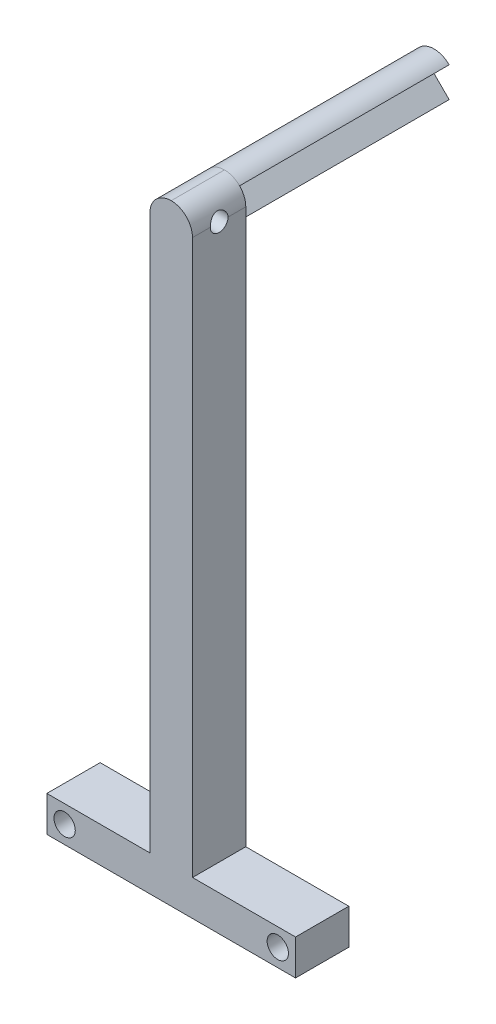
from build123d import *

# Parameters (mm, degrees)
BOSS_EXTRU_1_DEPTH      = 59
BOSS_EXTRU_2_DEPTH      = 15
CONG_1_R                = 6
BOSS_EXTRU_3_DEPTH      = 150
ESQUISSE5_W             = 15
ESQUISSE5_H             = 10
BOSS_EXTRU_4_DEPTH      = 35
ENL_V_MAT_EXTRU_1_REACH = 187.086
ESQUISSE6_R             = 3
ENL_V_MAT_EXTRU_2_REACH = 188.314


with BuildPart() as part:
    # Esquisse1 → Boss.-Extru.1 (new body)
    with BuildSketch(Plane.XY):
        with BuildLine():
            Line((4.242640687, -4.242640687), (0, 0))
            Line((0, 0), (0, 6))
            ThreePointArc((0, 6), (-5.543277195, -2.296100594), (4.242640687, -4.242640687))
        make_face()
        with BuildLine():
            Line((0, 6), (0, 0))
            Line((0, 0), (4.242640687, 4.242640687))
            ThreePointArc((4.242640687, 4.242640687), (2.296100594, 5.543277195), (0, 6))
        make_face()
    extrude(amount=BOSS_EXTRU_1_DEPTH)

    # Esquisse2 → Boss.-Extru.2 (add)
    with BuildSketch(Plane.XY.offset(59)):
        with BuildLine():
            ThreePointArc((0, -6), (-4.242640708, -4.242640666), (-6, 5.9e-08))
            Line((-6, 5.9e-08), (-6, -6))
            Line((-6, -6), (0, -6))
        make_face()
        with BuildLine():
            Line((0, 0), (0, 6))
            ThreePointArc((0, 6), (-4.242640666, 4.242640708), (-6, 5.9e-08))
            ThreePointArc((-6, 5.9e-08), (-4.242640708, -4.242640666), (0, -6))
            Line((0, -6), (0, 0))
        make_face()
        with BuildLine():
            ThreePointArc((4.242640687, 4.242640687), (2.296100594, 5.543277195), (0, 6))
            Line((0, 6), (0, 0))
            Line((0, 0), (4.242640687, 4.242640687))
        make_face()
        with BuildLine():
            Line((6, 6), (0, 6))
            ThreePointArc((0, 6), (2.296100594, 5.543277195), (4.242640687, 4.242640687))
            Line((4.242640687, 4.242640687), (0, 0))
            Line((0, 0), (4.242640687, -4.242640687))
            ThreePointArc((4.242640687, -4.242640687), (2.296100594, -5.543277195), (0, -6))
            Line((0, -6), (6, -6))
            Line((6, -6), (6, 6))
        make_face()
        with BuildLine():
            ThreePointArc((-6, 5.9e-08), (-4.242640666, 4.242640708), (0, 6))
            Line((0, 6), (-6, 6))
            Line((-6, 6), (-6, 5.9e-08))
        make_face()
        with BuildLine():
            Line((4.242640687, -4.242640687), (0, 0))
            Line((0, 0), (0, -6))
            ThreePointArc((0, -6), (2.296100594, -5.543277195), (4.242640687, -4.242640687))
        make_face()
    extrude(amount=BOSS_EXTRU_2_DEPTH)

    # Congé1
    cong_1_edges = [part.edges().sort_by_distance(p)[0] for p in [
        (6, 6, 66.5),
        (-6, 6, 66.5),
    ]]
    fillet(cong_1_edges, radius=CONG_1_R - 0.0001)  # a hair under: the kernel refuses the full size

    # Esquisse4 → Boss.-Extru.3 (add)
    with BuildSketch(Plane.XZ.offset(6)):
        Polygon((0, 59), (6, 59), (6, 74), (-6, 74), (-6, 59), align=None)
    extrude(amount=BOSS_EXTRU_3_DEPTH)

    # Esquisse5 → Boss.-Extru.4 (add, symmetric)
    with BuildSketch(Plane(origin=(0, 0, 0), x_dir=(0, 0, -1), z_dir=(1, 0, 0))):
        with Locations((-66.5, -161)):
            Rectangle(ESQUISSE5_W, ESQUISSE5_H)
    extrude(amount=BOSS_EXTRU_4_DEPTH, both=True)

    # Esquisse6 → Enlèv. mat.-Extru.1 (cut, up to next)
    with BuildSketch(Plane.XY.offset(74), mode=Mode.PRIVATE) as enl_v_mat_extru_1_sk1:
        with Locations((-30, -161)):
            Circle(ESQUISSE6_R)
    enl_v_mat_extru_1_tool1 = extrude(enl_v_mat_extru_1_sk1.sketch, amount=-ENL_V_MAT_EXTRU_1_REACH, mode=Mode.PRIVATE) & part.part
    # Esquisse6 → Enlèv. mat.-Extru.1 (cut, up to next)
    with BuildSketch(Plane.XY.offset(74), mode=Mode.PRIVATE) as enl_v_mat_extru_1_sk2:
        with Locations((30, -161)):
            Circle(ESQUISSE6_R)
    enl_v_mat_extru_1_tool2 = extrude(enl_v_mat_extru_1_sk2.sketch, amount=-ENL_V_MAT_EXTRU_1_REACH, mode=Mode.PRIVATE) & part.part
    add(enl_v_mat_extru_1_tool1.solids().sort_by_distance((-30, -161, 74))[0], mode=Mode.SUBTRACT)
    add(enl_v_mat_extru_1_tool2.solids().sort_by_distance((30, -161, 74))[0], mode=Mode.SUBTRACT)

    # Esquisse7 → Enlèv. mat.-Extru.2 (cut, up to next)
    with BuildSketch(Plane(origin=(6, 0, 0), x_dir=(0, 0, -1), z_dir=(1, 0, 0)), mode=Mode.PRIVATE) as enl_v_mat_extru_2_sk1:
        with BuildLine():
            ThreePointArc((-69, 0), (-66.5, -2.5), (-64, 0))
            Line((-64, 0), (-69, 0))
        make_face()
    enl_v_mat_extru_2_tool1 = extrude(enl_v_mat_extru_2_sk1.sketch, amount=-ENL_V_MAT_EXTRU_2_REACH, mode=Mode.PRIVATE) & part.part
    # Esquisse7 → Enlèv. mat.-Extru.2 (cut, up to next)
    with BuildSketch(Plane(origin=(6, 0, 0), x_dir=(0, 0, -1), z_dir=(1, 0, 0)), mode=Mode.PRIVATE) as enl_v_mat_extru_2_sk2:
        with BuildLine():
            Line((-69, 0), (-64, 0))
            ThreePointArc((-64, 0), (-66.5, 2.5), (-69, 0))
        make_face()
    enl_v_mat_extru_2_tool2 = extrude(enl_v_mat_extru_2_sk2.sketch, amount=-ENL_V_MAT_EXTRU_2_REACH, mode=Mode.PRIVATE) & part.part
    # Esquisse7 → Enlèv. mat.-Extru.2 (cut, up to next)
    with BuildSketch(Plane(origin=(6, 0, 0), x_dir=(0, 0, -1), z_dir=(1, 0, 0)), mode=Mode.PRIVATE) as enl_v_mat_extru_2_sk3:
        with BuildLine():
            ThreePointArc((-69, 0), (-66.5, -2.5), (-64, 0))
            Line((-64, 0), (-69, 0))
        make_face()
    enl_v_mat_extru_2_tool3 = extrude(enl_v_mat_extru_2_sk3.sketch, amount=-ENL_V_MAT_EXTRU_2_REACH, mode=Mode.PRIVATE) & part.part
    # Esquisse7 → Enlèv. mat.-Extru.2 (cut, up to next)
    with BuildSketch(Plane(origin=(6, 0, 0), x_dir=(0, 0, -1), z_dir=(1, 0, 0)), mode=Mode.PRIVATE) as enl_v_mat_extru_2_sk4:
        with BuildLine():
            Line((-69, 0), (-64, 0))
            ThreePointArc((-64, 0), (-66.5, 2.5), (-69, 0))
        make_face()
    enl_v_mat_extru_2_tool4 = extrude(enl_v_mat_extru_2_sk4.sketch, amount=-ENL_V_MAT_EXTRU_2_REACH, mode=Mode.PRIVATE) & part.part
    add(enl_v_mat_extru_2_tool1.solids().sort_by_distance((6, -1.061033, 66.5))[0], mode=Mode.SUBTRACT)
    add(enl_v_mat_extru_2_tool2.solids().sort_by_distance((6, 1.061033, 66.5))[0], mode=Mode.SUBTRACT)
    add(enl_v_mat_extru_2_tool3.solids().sort_by_distance((6, -1.061033, 66.5))[0], mode=Mode.SUBTRACT)
    add(enl_v_mat_extru_2_tool4.solids().sort_by_distance((6, 1.061033, 66.5))[0], mode=Mode.SUBTRACT)


solid = part.part
